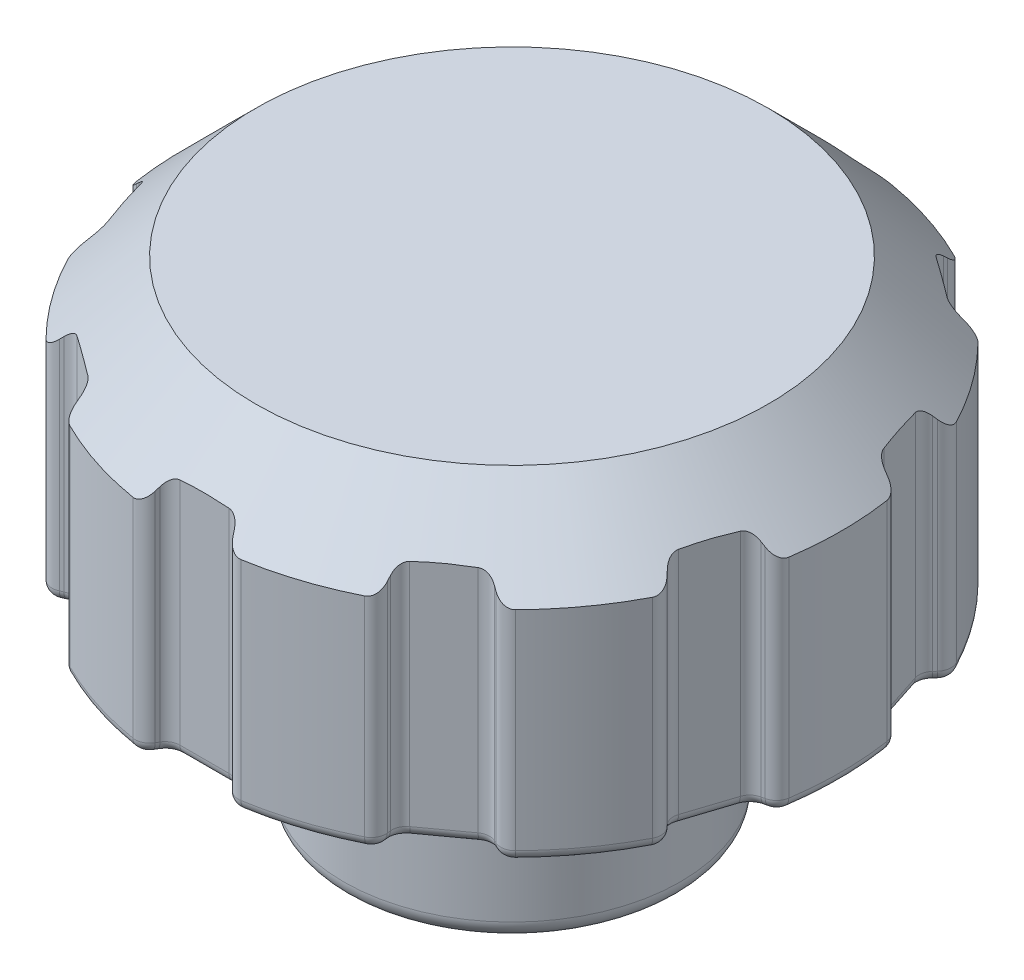
from build123d import *

# Parameters (mm, degrees)
SKIZZE1_R                       = 9
AUFSATZ_LINEAR_AUSTRAGEN1_DEPTH = 8
SKIZZE2_R                       = 4.6
AUFSATZ_LINEAR_AUSTRAGEN2_DEPTH = 5
SCHNITT_LINEAR_AUSTRAGEN2_DEPTH = 6.5
VERRUNDUNG1_SIZE                = 2
SCHNITT_LINEAR_AUSTRAGEN3_DEPTH = 19.193405399
KREISMUSTER1_COUNT              = 10
VERRUNDUNG2_R                   = 0.4
VERRUNDUNG3_R                   = 0.3
VERRUNDUNG4_R                   = 0.5
FASE1_SIZE                      = 0.7


with BuildPart() as part:
    # Skizze1 → Aufsatz-Linear austragen1 (new body)
    with BuildSketch(Plane(origin=(0, 0, 0), x_dir=(1, 0, 0), z_dir=(0, 1, 0))):
        Circle(SKIZZE1_R)
    extrude(amount=AUFSATZ_LINEAR_AUSTRAGEN1_DEPTH)

    # Skizze2 → Aufsatz-Linear austragen2 (add)
    with BuildSketch(Plane.XZ):
        Circle(SKIZZE2_R)
    extrude(amount=AUFSATZ_LINEAR_AUSTRAGEN2_DEPTH)

    # Skizze3 → Schnitt-Linear austragen2 (cut)
    with BuildSketch(Plane.XZ.offset(5)):
        with BuildLine():
            ThreePointArc((1.2, 2.858321186), (-3.1, 0), (1.2, -2.858321186))
            Line((1.2, -2.858321186), (1.2, 2.858321186))
        make_face()
    extrude(amount=-SCHNITT_LINEAR_AUSTRAGEN2_DEPTH, mode=Mode.SUBTRACT)

    # Verrundung1
    verrundung1_edges = [part.edges().sort_by_distance(p)[0] for p in [
        (-9, 8, 0),
    ]]
    chamfer(verrundung1_edges, length=VERRUNDUNG1_SIZE)

    # Skizze4 → Schnitt-Linear austragen3 (cut, through all)
    with BuildSketch(Plane(origin=(0, 8, 0), x_dir=(1, 0, 0), z_dir=(0, 1, 0))):
        Polygon((26.819251744, 53.29348692), (1.2, 8.919641248), (0.899984985, 8.4), (-0.899984985, 8.4), (-1.2, 8.919641248), (-26.819251744, 53.29348692), (-26.819251744, 155.770493895), (26.819251744, 155.770493895), align=None)
    schnitt_linear_austragen3 = extrude(amount=-SCHNITT_LINEAR_AUSTRAGEN3_DEPTH, mode=Mode.SUBTRACT)

    # Kreismuster1: Schnitt-Linear austragen3 ×10 about axis
    kreismuster1_axis = Axis((0, -5.65, 0), (0, 1, 0))
    for i in range(1, KREISMUSTER1_COUNT):
        add(schnitt_linear_austragen3.rotate(kreismuster1_axis, i * 360 / KREISMUSTER1_COUNT), mode=Mode.SUBTRACT)

    # Verrundung2
    verrundung2_edges = [part.edges().sort_by_distance(p)[0] for p in [
        (-1.2, 3, -8.919641248),
        (-0.899984985, 3.275962448, -8.4),
        (1.2, 3, -8.919641248),
        (0.899984985, 3.275962448, -8.4),
        (4.209292971, 3.275962448, -7.324740654),
        (4.272013188, 3, -7.921483656),
        (-4.272013188, 3, -7.921483656),
        (-4.209292971, 3.275962448, -7.324740654),
        (-5.665499267, 3.275962448, -6.266744851),
        (-6.213653975, 3, -6.510799051),
        (-8.112262539, 3, -3.897588549),
        (-7.710764082, 3.275962448, -3.451679338),
        (-8.266985392, 3.275962448, -1.739806168),
        (-8.853903326, 3, -1.61505291),
        (-8.853903326, 3, 1.61505291),
        (-8.266985392, 3.275962448, 1.739806168),
        (-7.710764082, 3.275962448, 3.451679338),
        (-8.112262539, 3, 3.897588549),
        (-6.213653975, 3, 6.510799051),
        (-5.665499267, 3.275962448, 6.266744851),
        (-4.209292971, 3.275962448, 7.324740654),
        (-4.272013188, 3, 7.921483656),
        (-1.2, 3, 8.919641248),
        (-0.899984985, 3.275962448, 8.4),
        (0.899984985, 3.275962448, 8.4),
        (1.2, 3, 8.919641248),
        (4.272013188, 3, 7.921483656),
        (4.209292971, 3.275962448, 7.324740654),
        (5.665499267, 3.275962448, 6.266744851),
        (6.213653975, 3, 6.510799051),
        (8.112262539, 3, 3.897588549),
        (7.710764082, 3.275962448, 3.451679338),
        (8.266985392, 3.275962448, 1.739806168),
        (8.853903326, 3, 1.61505291),
        (8.853903326, 3, -1.61505291),
        (8.266985392, 3.275962448, -1.739806168),
        (7.710764082, 3.275962448, -3.451679338),
        (8.112262539, 3, -3.897588549),
        (6.213653975, 3, -6.510799051),
        (5.665499267, 3.275962448, -6.266744851),
    ]]
    fillet(verrundung2_edges, radius=VERRUNDUNG2_R)

    # Verrundung3
    verrundung3_edges = [part.edges().sort_by_distance(p)[0] for p in [
        (1.239308263, 0, -8.845291924),
        (1.039589207, 0, -8.641801605),
        (0.869044878, 0, -8.453589838),
        (0, 0, -8.4),
        (-0.869044878, 0, -8.453589838),
        (-1.039589207, 0, -8.641801605),
        (-1.239308263, 0, -8.845291924),
        (-2.781152949, 0, -8.559508647),
        (-4.196510699, 0, -7.884438607),
        (-4.238478201, 0, -7.602419564),
        (-4.265823361, 0, -7.349909605),
        (-4.937396119, 0, -6.795742753),
        (-5.671967511, 0, -6.32828608),
        (-5.920568872, 0, -6.380309156),
        (-6.201753591, 0, -6.427544366),
        (-7.281152949, 0, -5.290067271),
        (-8.029405208, 0, -3.911997724),
        (-7.897590996, 0, -3.659171647),
        (-7.771292066, 0, -3.438813717),
        (-7.988874737, 0, -2.595742753),
        (-8.308391338, 0, -1.78579213),
        (-8.540092461, 0, -1.681755468),
        (-8.795339837, 0, -1.554693325),
        (-9, 0, 0),
        (-8.795339837, 0, 1.554693325),
        (-8.540092461, 0, 1.681755468),
        (-8.308391338, 0, 1.78579213),
        (-7.988874737, 0, 2.595742753),
        (-7.771292066, 0, 3.438813717),
        (-7.897590996, 0, 3.659171647),
        (-8.029405208, 0, 3.911997724),
        (-7.281152949, 0, 5.290067271),
        (-6.201753591, 0, 6.427544366),
        (-5.920568872, 0, 6.380309156),
        (-5.671967511, 0, 6.32828608),
        (-4.937396119, 0, 6.795742753),
        (-4.265823361, 0, 7.349909605),
        (-4.238478201, 0, 7.602419564),
        (-4.196510699, 0, 7.884438607),
        (-2.781152949, 0, 8.559508647),
        (-1.239308263, 0, 8.845291924),
        (-1.039589207, 0, 8.641801605),
        (-0.869044878, 0, 8.453589838),
        (0, 0, 8.4),
        (0.869044878, 0, 8.453589838),
        (1.039589207, 0, 8.641801605),
        (1.239308263, 0, 8.845291924),
        (2.781152949, 0, 8.559508647),
        (4.196510699, 0, 7.884438607),
        (4.238478201, 0, 7.602419564),
        (4.265823361, 0, 7.349909605),
        (4.937396119, 0, 6.795742753),
        (5.671967511, 0, 6.32828608),
        (5.920568872, 0, 6.380309156),
        (6.201753591, 0, 6.427544366),
        (7.281152949, 0, 5.290067271),
        (8.029405208, 0, 3.911997724),
        (7.897590996, 0, 3.659171647),
        (7.771292066, 0, 3.438813717),
        (7.988874737, 0, 2.595742753),
        (8.308391338, 0, 1.78579213),
        (8.540092461, 0, 1.681755468),
        (8.795339837, 0, 1.554693325),
        (9, 0, 0),
        (8.795339837, 0, -1.554693325),
        (8.540092461, 0, -1.681755468),
        (8.308391338, 0, -1.78579213),
        (7.988874737, 0, -2.595742753),
        (7.771292066, 0, -3.438813717),
        (7.897590996, 0, -3.659171647),
        (8.029405208, 0, -3.911997724),
        (7.281152949, 0, -5.290067271),
        (6.201753591, 0, -6.427544366),
        (5.920568872, 0, -6.380309156),
        (5.671967511, 0, -6.32828608),
        (4.937396119, 0, -6.795742753),
        (4.265823361, 0, -7.349909605),
        (4.238478201, 0, -7.602419564),
        (4.196510699, 0, -7.884438607),
        (2.781152949, 0, -8.559508647),
        (-4.6, 0, 0),
    ]]
    fillet(verrundung3_edges, radius=VERRUNDUNG3_R)

    # Verrundung4
    verrundung4_edges = [part.edges().sort_by_distance(p)[0] for p in [
        (-4.6, -5, 0),
    ]]
    fillet(verrundung4_edges, radius=VERRUNDUNG4_R)

    # Fase1
    fase1_edges = [part.edges().sort_by_distance(p)[0] for p in [
        (1.2, -5, 0),
        (-3.1, -5, 0),
    ]]
    chamfer(fase1_edges, length=FASE1_SIZE)


solid = part.part
